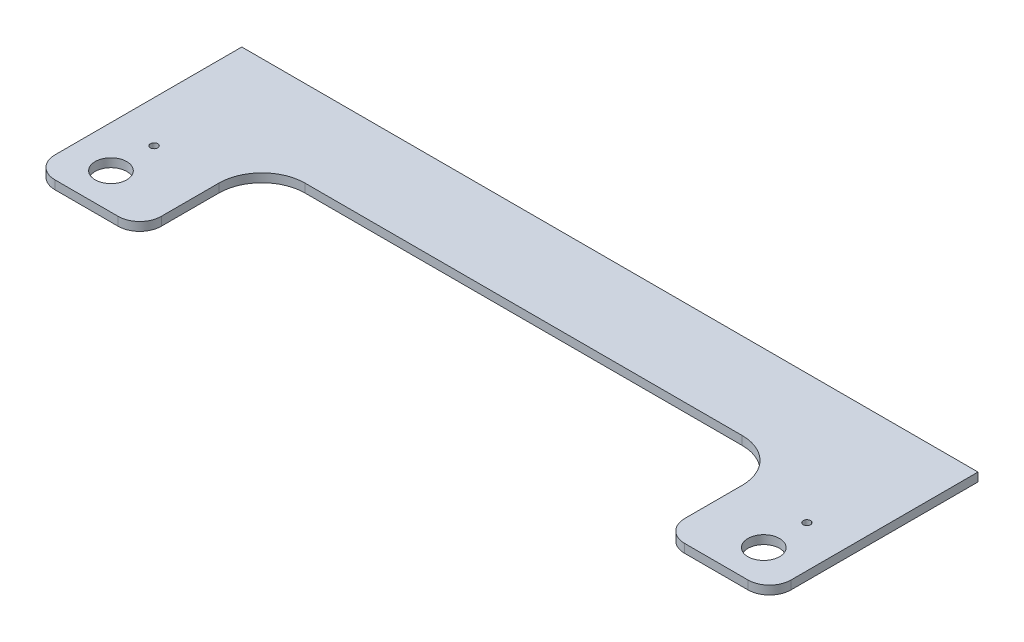
from build123d import *

# Parameters (mm, degrees)
SKETCH_1_R               = 2.55
EXTRUDE_1_DEPTH          = 6
CUT_EXTRUDE_1_DEPTH      = 14
CUT_EXTRUDE_1_DEPTH_BACK = 5
SKETCH_7_R               = 11
CUT_EXTRUDE_2_DEPTH      = 11
CUT_EXTRUDE_2_DEPTH_BACK = 5
SKETCH_8_R               = 11


with BuildPart() as part:
    # Эскиз1 → Бобышка-Вытянуть1 (new body)
    with BuildSketch(Plane(origin=(0, 0, 0), x_dir=(1, 0, 0), z_dir=(0, 1, 0))):
        with BuildLine():
            Line((-322.202898551, -10), (-322.202898551, 120))
            Line((-322.202898551, 120), (189.797101449, 120))
            Line((189.797101449, 120), (189.797101449, -10))
            ThreePointArc((189.797101449, -10), (185.403703167, -20.606601718), (174.797101449, -25))
            Line((174.797101449, -25), (130.797101449, -25))
            ThreePointArc((130.797101449, -25), (120.190499731, -20.606601718), (115.797101449, -10))
            Line((115.797101449, -10), (115.797101449, 30))
            ThreePointArc((115.797101449, 30), (107.010304885, 51.213203436), (85.797101449, 60))
            Line((85.797101449, 60), (-218.202898551, 60))
            ThreePointArc((-218.202898551, 60), (-239.416101986, 51.213203436), (-248.202898551, 30))
            Line((-248.202898551, 30), (-248.202898551, -10))
            ThreePointArc((-248.202898551, -10), (-252.596296833, -20.606601718), (-263.202898551, -25))
            Line((-263.202898551, -25), (-307.202898551, -25))
            ThreePointArc((-307.202898551, -25), (-317.809500269, -20.606601718), (-322.202898551, -10))
        make_face()
        with Locations((-293.202898551, 30)):
            Circle(SKETCH_1_R, mode=Mode.SUBTRACT)
        with Locations((160.797101449, 30)):
            Circle(SKETCH_1_R, mode=Mode.SUBTRACT)
    extrude(amount=EXTRUDE_1_DEPTH)

    # Эскиз7 → Вырез-Вытянуть1 (cut, two sides: drawn at the far end of the back side and taken through both)
    with BuildSketch(Plane(origin=(0, 0, 0), x_dir=(1, 0, 0), z_dir=(0, 1, 0)).offset(-CUT_EXTRUDE_1_DEPTH_BACK)):
        with Locations((-293.202898551, 0)):
            Circle(SKETCH_7_R)
    extrude(amount=CUT_EXTRUDE_1_DEPTH + CUT_EXTRUDE_1_DEPTH_BACK, mode=Mode.SUBTRACT)

    # Эскиз8 → Вырез-Вытянуть2 (cut, two sides: drawn at the far end of the back side and taken through both)
    with BuildSketch(Plane(origin=(0, 0, 0), x_dir=(1, 0, 0), z_dir=(0, 1, 0)).offset(-CUT_EXTRUDE_2_DEPTH_BACK)):
        with Locations((160.797101449, 0)):
            Circle(SKETCH_8_R)
    extrude(amount=CUT_EXTRUDE_2_DEPTH + CUT_EXTRUDE_2_DEPTH_BACK, mode=Mode.SUBTRACT)


solid = part.part
